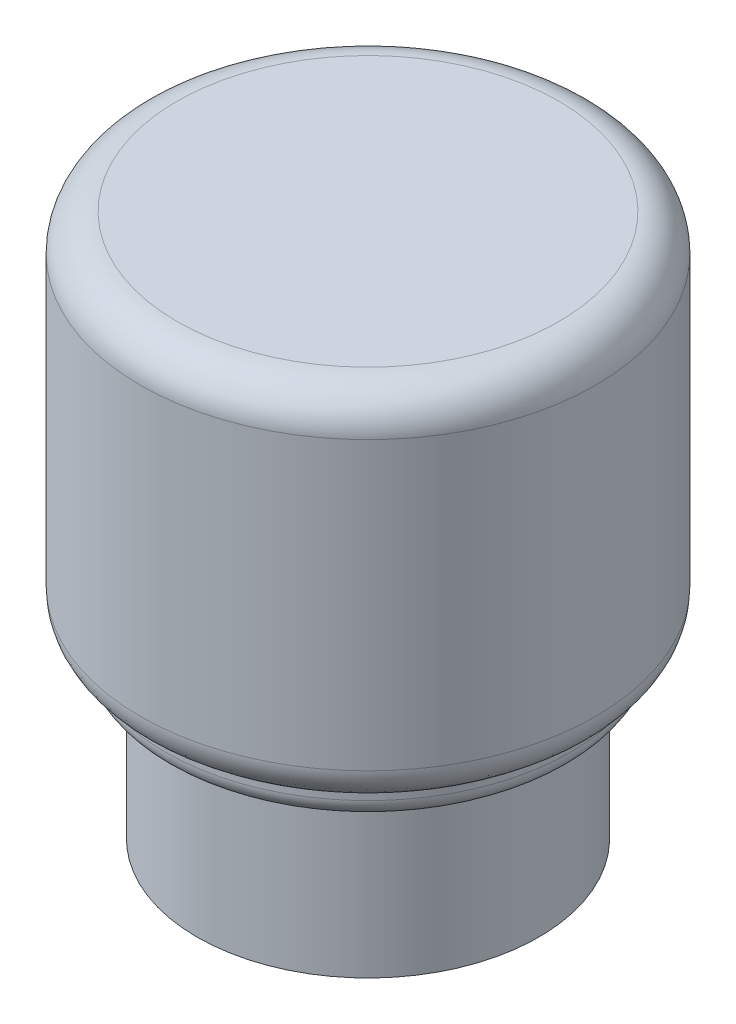
from build123d import *

# Parameters (mm, degrees)
FILLET_2_R = 1
FILLET_3_R = 1
FILLET_4_R = 0.5


with BuildPart() as part:
    # 草图1 → 旋转1 (revolve)
    with BuildSketch(Plane.XY, mode=Mode.PRIVATE) as revolve_1_sk:
        Polygon((-1.191258072, 14.485690889), (5, 14.485690889), (5, 4.736615531), (4.320409463, 4.736615531), (4.320409463, 4.0022434), (3.455669657, 4.0022434), (3.455669657, -0.286866039), (-1.191258072, -0.286866039), (-1.191258072, 4.0022434), (-1.191258072, 7.594094591), align=None)
    revolve(revolve_1_sk.sketch.rotate(Axis((-1.191258072, 7.594094591, 0), (0, 1, 0)), 90), axis=Axis((-1.191258072, 7.594094591, 0), (0, 1, 0)))

    # 圆角2
    fillet_2_edges = [part.edges().sort_by_distance(p)[0] for p in [
        (-1.191258072, 14.485690889, 6.191258072),
    ]]
    fillet(fillet_2_edges, radius=FILLET_2_R)

    # 圆角3
    # the kernel refuses this fillet: 1 mm, written as the material it takes off along each edge
    with BuildSketch(Plane(origin=(-1.191258072, 4.736615531, 0), x_dir=(0, 0, -1), z_dir=(1, 0, 0))) as fillet_3_piece_1:
        with BuildLine():
            CenterArc((5.191258072, 0.947279144), FILLET_3_R, 288.687689278, 71.312310722)
            Line((5.511667536, 0), (5.518075725, -0.018945583))
            ThreePointArc((5.518075725, -0.018945583), (5.851462804, -0.02), (6.191258072, -0.02))
            Line((6.191258072, -0.02), (6.211258072, 0))
            Line((6.211258072, 0), (6.211258072, 0.947279144))
            Line((6.211258072, 0.947279144), (6.191258072, 0.947279144))
        make_face()
    revolve(axis=Axis((-1.191258072, 4.736615531, 0), (0, 1, 0)), mode=Mode.SUBTRACT)

    # 圆角4
    fillet_4_edges = [part.edges().sort_by_distance(p)[0] for p in [
        (-1.191258072, 4.0022434, 5.511667536),
    ]]
    fillet(fillet_4_edges, radius=FILLET_4_R)


solid = part.part
